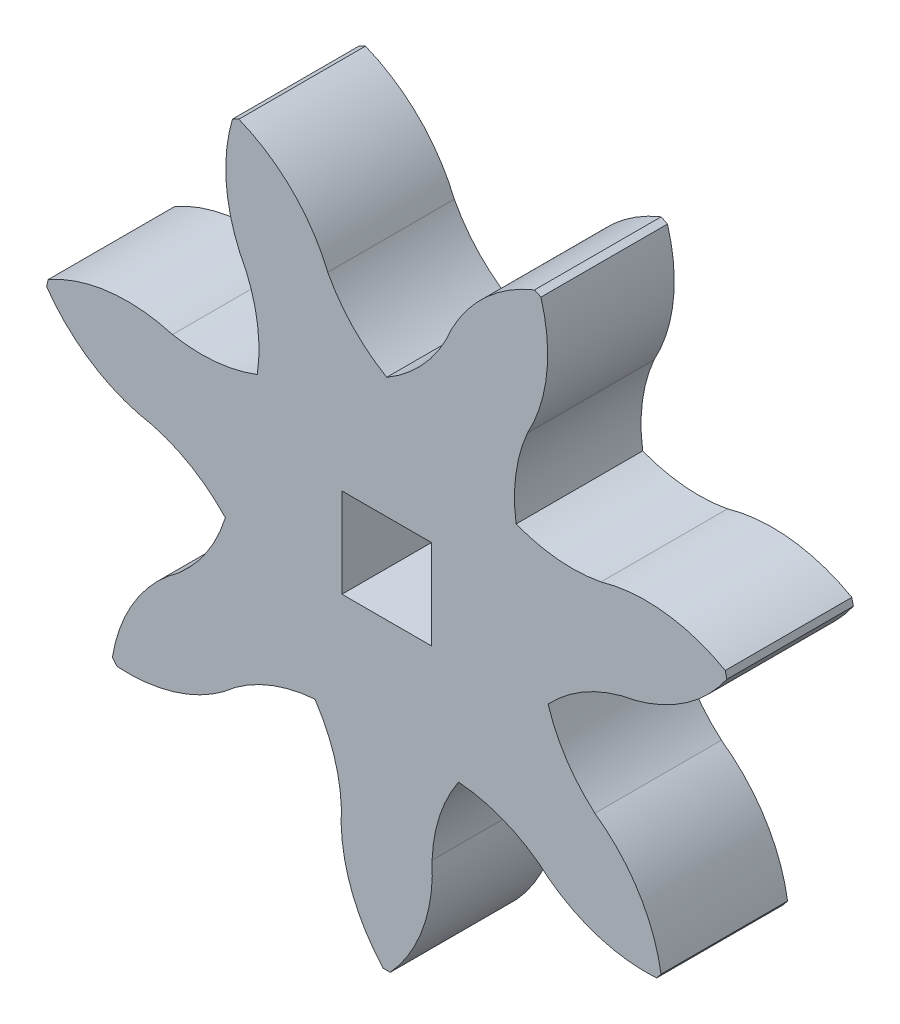
from build123d import *

# Parameters (mm, degrees)
SKETCH1_R           = 27.5
SKETCH1_W           = 7.071067812
SKETCH1_H           = 7.071067812
BOSS_EXTRUDE1_DEPTH = 10
CUT_EXTRUDE1_DEPTH  = 41.155946011
CIRPATTERN1_COUNT   = 7


with BuildPart() as part:
    # Sketch1 → Boss-Extrude1 (new body)
    with BuildSketch(Plane.XY):
        Circle(SKETCH1_R)
        Rectangle(SKETCH1_W, SKETCH1_H, mode=Mode.SUBTRACT)
    extrude(amount=BOSS_EXTRUDE1_DEPTH)

    # Sketch2 → Cut-Extrude1 (cut, through all)
    with BuildSketch(Plane.XY):
        with BuildLine():
            ThreePointArc((-12.085676639, 25.052643791), (-7.610373405, 31.966803979), (0, 35.115798545))
            ThreePointArc((0, 35.115798545), (7.610373405, 31.966803979), (12.085676639, 25.052643791))
            ThreePointArc((12.085676639, 25.052643791), (7.621505597, 22.275656854), (4.658453723, 17.932754237))
            ThreePointArc((4.658453723, 17.932754237), (2.670118232, 15.177944139), (0, 13.07724775))
            ThreePointArc((0, 13.07724775), (-2.670118232, 15.177944139), (-4.658453723, 17.932754237))
            ThreePointArc((-4.658453723, 17.932754237), (-7.621505597, 22.275656854), (-12.085676639, 25.052643791))
        make_face()
    cut_extrude1 = extrude(amount=CUT_EXTRUDE1_DEPTH, mode=Mode.SUBTRACT)

    # CirPattern1: Cut-Extrude1 ×7 about axis
    cirpattern1_axis = Axis((0, 0, 10), (0, 0, -1))
    for i in range(1, CIRPATTERN1_COUNT):
        add(cut_extrude1.rotate(cirpattern1_axis, i * 360 / CIRPATTERN1_COUNT), mode=Mode.SUBTRACT)


solid = part.part
